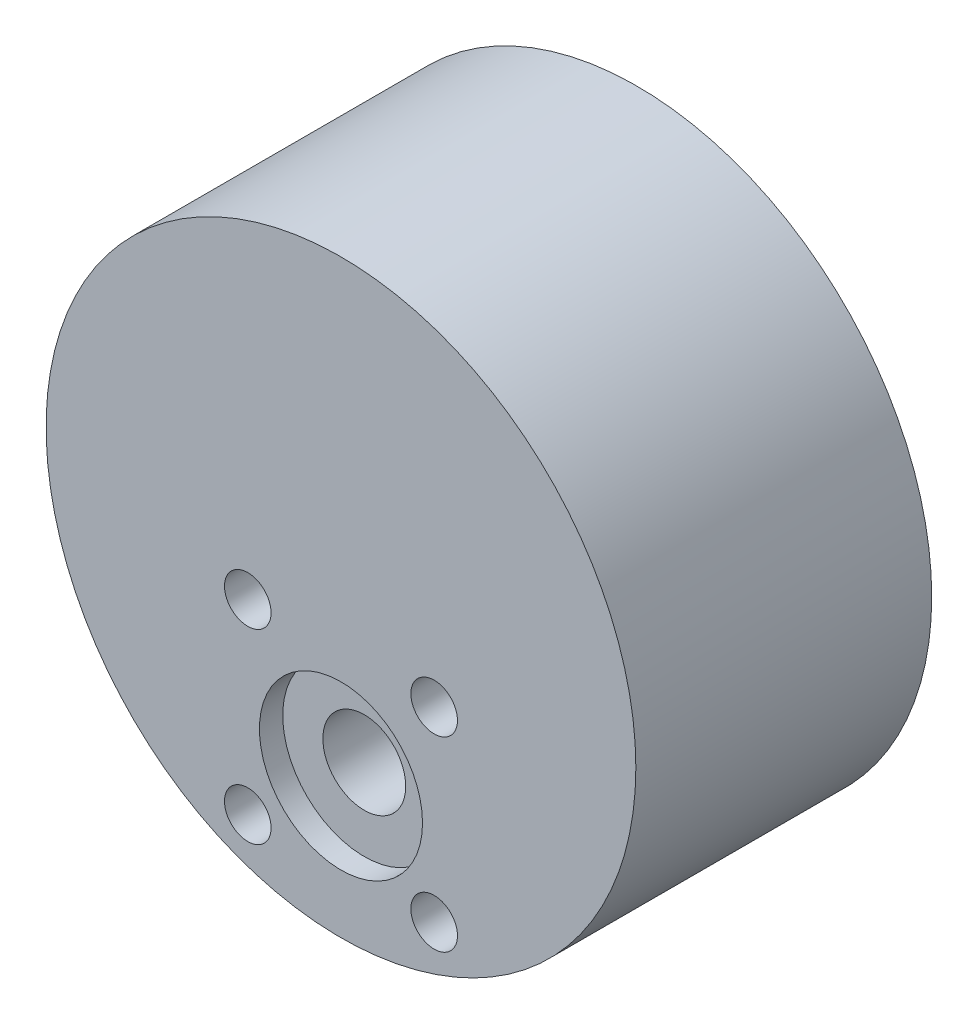
from build123d import *

# Parameters (mm, degrees)
SKETCH1_R           = 25.314646171
BOSS_EXTRUDE1_DEPTH = 25.4
SKETCH2_R           = 3.556
CUT_EXTRUDE1_DEPTH  = 25.4
SKETCH3_R           = 7
SKETCH3_R_2         = 3.556
CUT_EXTRUDE2_DEPTH  = 2
SKETCH4_R           = 2
CUT_EXTRUDE3_DEPTH  = 44.895587722


with BuildPart() as part:
    # Sketch1 → Boss-Extrude1 (new body)
    with BuildSketch(Plane.XY):
        Circle(SKETCH1_R)
    extrude(amount=BOSS_EXTRUDE1_DEPTH)

    # Sketch2 → Cut-Extrude1 (cut)
    with BuildSketch(Plane.XY.offset(25.4)):
        with Locations((0, -13.278788033)):
            Circle(SKETCH2_R)
    extrude(amount=-CUT_EXTRUDE1_DEPTH, mode=Mode.SUBTRACT)

    # Sketch3 → Cut-Extrude2 (cut)
    with BuildSketch(Plane.XY.offset(25.4)):
        with Locations((0, -13.278788033)):
            Circle(SKETCH3_R)
        with Locations((0, -13.278788033)):
            Circle(SKETCH3_R_2, mode=Mode.SUBTRACT)
    extrude(amount=-CUT_EXTRUDE2_DEPTH, mode=Mode.SUBTRACT)

    # Sketch4 → Cut-Extrude3 (cut, through all)
    with BuildSketch(Plane.XY.offset(25.4)):
        with Locations((-8, -4.158160147)):
            Circle(SKETCH4_R)
        with Locations((8, -4.158160147)):
            Circle(SKETCH4_R)
        with Locations((8, -20.158160147)):
            Circle(SKETCH4_R)
        with Locations((-8, -20.158160147)):
            Circle(SKETCH4_R)
    extrude(amount=-CUT_EXTRUDE3_DEPTH, mode=Mode.SUBTRACT)


solid = part.part
